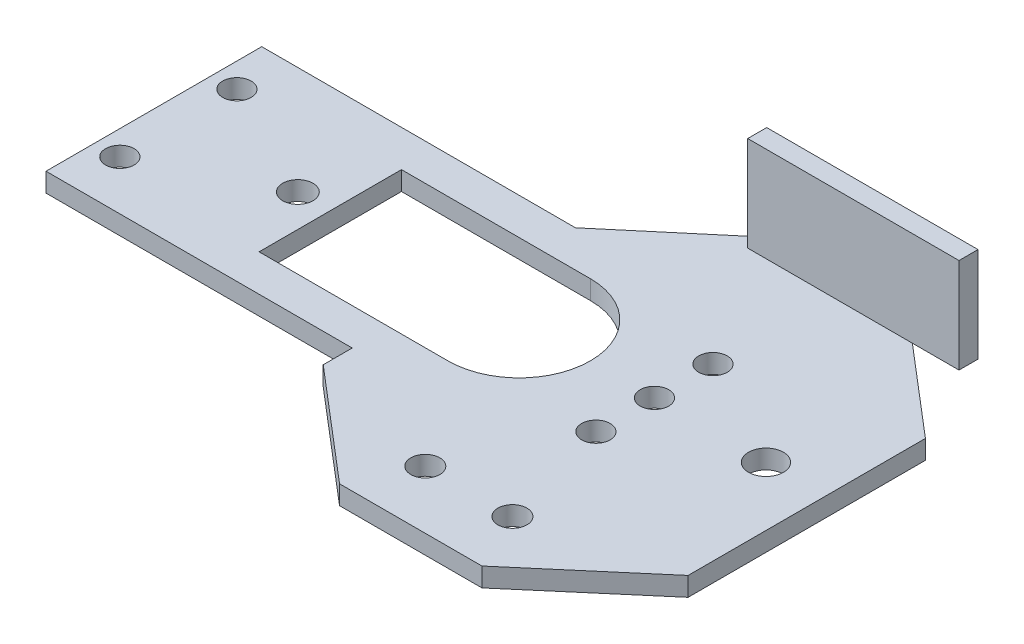
from build123d import *

# Parameters (mm, degrees)
CROQUIS1_R              = 1.53
CROQUIS1_R_2            = 1.837919526
CROQUIS1_R_3            = 1.597275243
CROQUIS1_R_4            = 1.5
SALIENTE_EXTRUIR1_DEPTH = 2
CROQUIS2_W              = 22.259388851
CROQUIS2_H              = 2
SALIENTE_EXTRUIR2_DEPTH = 10
CROQUIS3_W              = 7.563533061
CROQUIS3_H              = 2
SALIENTE_EXTRUIR3_DEPTH = 10


with BuildPart() as part:
    # Croquis1 → Saliente-Extruir1 (new body)
    with BuildSketch(Plane(origin=(0, 0, 0), x_dir=(1, 0, 0), z_dir=(0, 1, 0))):
        Polygon((-26.514888395, -10.582637626), (-26.514888395, -7.527182045), (-40.886979894, -7.527182045), (-58.77250276, -7.527182045), (-58.77250276, 15.200062733), (-41.405808266, 15.200062733), (-25.724953766, 15.200062733), (-14.794888395, 24.417362374), (0.205111605, 24.417362374), (11.925111605, 14.417362374), (11.925111605, -10.582637626), (0.205111605, -20.582637626), (-14.794888395, -20.582637626), align=None)
        with Locations((-11.884888395, -14.457637626)):
            Circle(CROQUIS1_R, mode=Mode.SUBTRACT)
        with Locations((-2.704888395, -14.457637626)):
            Circle(CROQUIS1_R, mode=Mode.SUBTRACT)
        with Locations((5.705111605, 3.842362374)):
            Circle(CROQUIS1_R_2, mode=Mode.SUBTRACT)
        with Locations((-43.610544187, 3.842362374)):
            Circle(CROQUIS1_R_3, mode=Mode.SUBTRACT)
        with Locations((-6.044888395, 3.842362374)):
            Circle(CROQUIS1_R_4, mode=Mode.SUBTRACT)
        with Locations((-6.044888395, 10.008584025)):
            Circle(CROQUIS1_R_4, mode=Mode.SUBTRACT)
        with Locations((-6.044888395, -2.323859276)):
            Circle(CROQUIS1_R_4, mode=Mode.SUBTRACT)
        with Locations((-56.194888395, 10.008584025)):
            Circle(CROQUIS1_R_4, mode=Mode.SUBTRACT)
        with Locations((-56.194888395, -2.323859276)):
            Circle(CROQUIS1_R_4, mode=Mode.SUBTRACT)
        with BuildLine():
            Line((-40.195554385, 11.342362374), (-20.294888395, 11.342362374))
            ThreePointArc((-20.294888395, 11.342362374), (-12.794888395, 3.842362374), (-20.294888395, -3.657637626))
            Line((-20.294888395, -3.657637626), (-40.195554385, -3.657637626))
            Line((-40.195554385, -3.657637626), (-40.195554385, 11.342362374))
        make_face(mode=Mode.SUBTRACT)
    extrude(amount=SALIENTE_EXTRUIR1_DEPTH)

    # Croquis2 → Saliente-Extruir2 (add)
    with BuildSketch(Plane(origin=(0, 2, 0), x_dir=(1, 0, 0), z_dir=(0, 1, 0))):
        with Locations((-3.66519397, 23.417362374)):
            Rectangle(CROQUIS2_W, CROQUIS2_H)
    extrude(amount=SALIENTE_EXTRUIR2_DEPTH)

    # Croquis3 → Saliente-Extruir3 (add)
    with BuildSketch(Plane.XZ):
        with Locations((-3.576654926, -23.417362374)):
            Rectangle(CROQUIS3_W, CROQUIS3_H)
    extrude(amount=SALIENTE_EXTRUIR3_DEPTH)


solid = part.part
